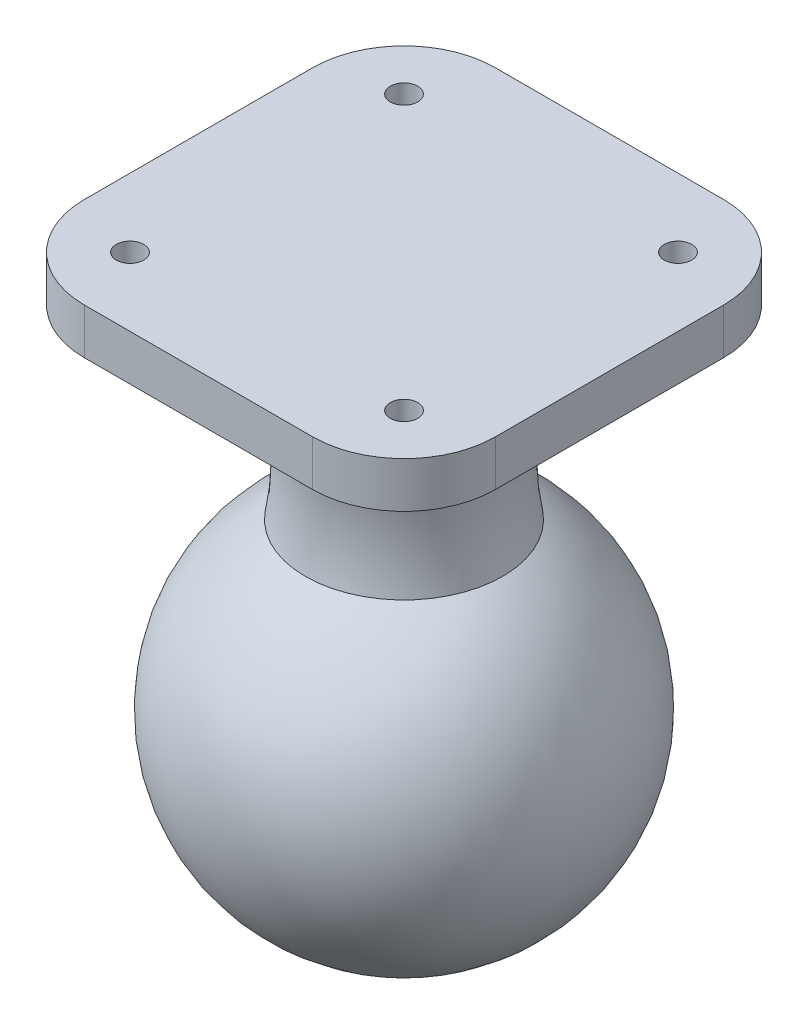
from build123d import *

# Parameters (mm, degrees)
SKETCH1_R           = 1.5
BOSS_EXTRUDE1_DEPTH = 5


with BuildPart() as part:
    # Sketch1 → Boss-Extrude1 (new body)
    with BuildSketch(Plane(origin=(0, 0, 0), x_dir=(1, 0, 0), z_dir=(0, 1, 0))):
        with BuildLine():
            Line((12.5, -22.5), (-12.5, -22.5))
            ThreePointArc((-12.5, -22.5), (-19.571067812, -19.571067812), (-22.5, -12.5))
            Line((-22.5, -12.5), (-22.5, 12.5))
            ThreePointArc((-22.5, 12.5), (-19.571067812, 19.571067812), (-12.5, 22.5))
            Line((-12.5, 22.5), (12.5, 22.5))
            ThreePointArc((12.5, 22.5), (19.571067812, 19.571067812), (22.5, 12.5))
            Line((22.5, 12.5), (22.5, -12.5))
            ThreePointArc((22.5, -12.5), (19.571067812, -19.571067812), (12.5, -22.5))
        make_face()
        with Locations((-15, 15)):
            Circle(SKETCH1_R, mode=Mode.SUBTRACT)
        with Locations((15, 15)):
            Circle(SKETCH1_R, mode=Mode.SUBTRACT)
        with Locations((15, -15)):
            Circle(SKETCH1_R, mode=Mode.SUBTRACT)
        with Locations((-15, -15)):
            Circle(SKETCH1_R, mode=Mode.SUBTRACT)
    extrude(amount=BOSS_EXTRUDE1_DEPTH)

    # Sketch5 → Revolve5 (revolve)
    with BuildSketch(Plane.XY):
        with BuildLine():
            Line((0, 0), (0, -30))
            Line((0, -30), (-14.490872109, -30))
            ThreePointArc((-14.490872109, -30), (-10.310219401, -15), (-14.490872109, 0))
            Line((-14.490872109, 0), (0, 0))
        make_face()
    revolve(axis=Axis((0, 6.623218914, 0), (0, -1, 0)))

    # Sketch6 → Revolve6 (revolve)
    with BuildSketch(Plane(origin=(0, 0, 0), x_dir=(0, 0, -1), z_dir=(1, 0, 0))):
        with BuildLine():
            Line((0, -17.323751058), (0, -59.119175033))
            ThreePointArc((0, -59.119175033), (-20.897711988, -38.221463045), (0, -17.323751058))
        make_face()
    revolve(axis=Axis((0, -62.962580504, 0), (0, 1, 0)))


solid = part.part
